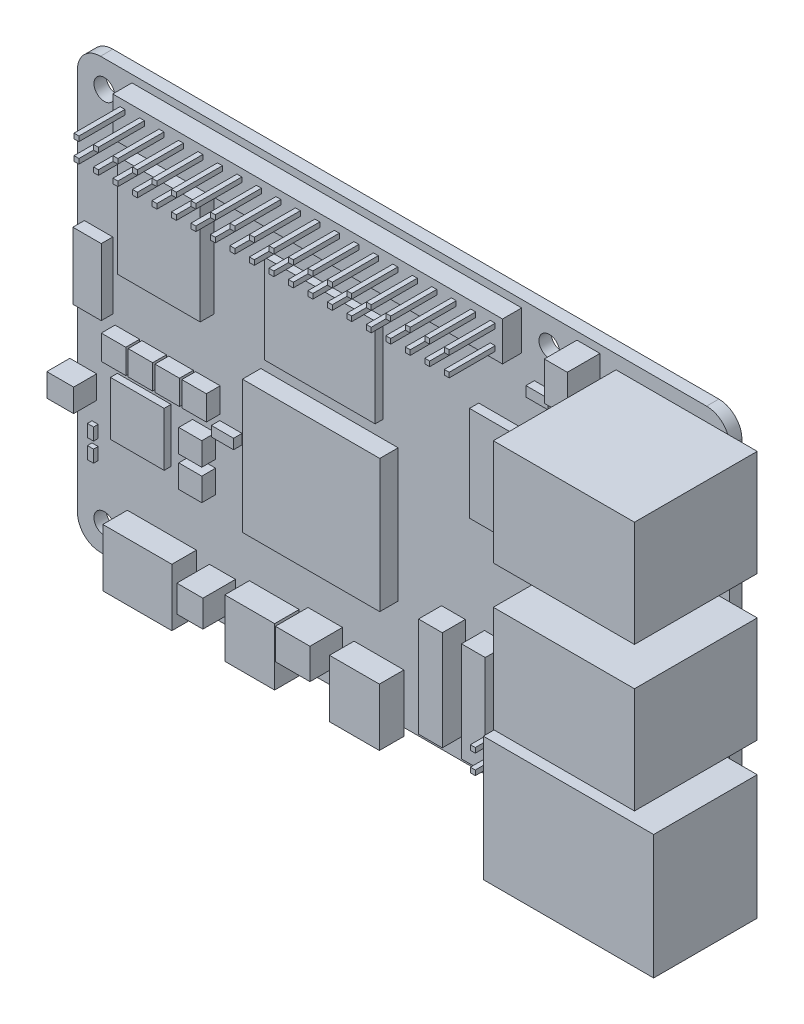
from build123d import *

# Parameters (mm, degrees)
PCB_DEPTH              = 1.6
SKETCH2_W              = 50.8
SKETCH2_H              = 5.08
SKETCH2_W_2            = 5.08
HEADER_BLOCKS_DEPTH    = 2.5
SKETCH3_W              = 0.64
SKETCH3_H              = 0.64
HEADER_PINS_DEPTH      = 6
SKETCH4_W              = 0.8
SKETCH4_H              = 1.6
PARTS_H0_6_DEPTH       = 0.6
SKETCH5_W              = 7
SKETCH5_H              = 7
PARTS_H0_9_DEPTH       = 0.9
SKETCH6_W              = 14.4
SKETCH6_H              = 11.6
SKETCH6_W_2            = 4
SKETCH6_H_2            = 4.5
PARTS_H1_DEPTH         = 1
SKETCH7_W              = 2.9
SKETCH7_H              = 1.3
PARTS_H1_1_DEPTH       = 1.1
SKETCH8_W              = 12.9
SKETCH8_H              = 12.4
PARTS_H1_2_DEPTH       = 1.2
SKETCH9_W              = 3.7
SKETCH9_H              = 8.7
PARTS_H1_5_DEPTH       = 1.5
SKETCH10_W             = 10.8
SKETCH10_H             = 13.3
SKETCH10_W_2           = 3.2
SKETCH10_H_2           = 3.2
SKETCH10_W_3           = 3
SKETCH10_H_3           = 3
PARTS_H1_8_DEPTH       = 1.8
SKETCH11_W             = 17.9
SKETCH11_H             = 17.3
PARTS_H2_4_DEPTH       = 2.4
SKETCH12_W             = 3.1
SKETCH12_H             = 13
SKETCH12_W_2           = 3.5
SKETCH12_H_2           = 3
PARTS_H3_DEPTH         = 3
SKETCH13_W             = 6.5
SKETCH13_H             = 7.5
SKETCH13_W_2           = 9
PARTS_H3_2_DEPTH       = 3.2
SKETCH14_W             = 3
SKETCH14_H             = 5
SKETCH14_W_2           = 4.5
SKETCH14_H_2           = 4
SKETCH14_W_3           = 3.4
SKETCH14_H_3           = 3.5
PARTS_H4_25_DEPTH      = 4.25
SKETCH15_W             = 22.2
SKETCH15_H             = 16.2
PARTS_H13_5_DEPTH      = 13.5
SKETCH16_W             = 18.4
SKETCH16_H             = 13.8
PARTS_H16_DEPTH        = 16
MOUNT_HOLES_DEPTH      = 107.281324794
MOUNT_HOLES_DEPTH_BACK = 107.281324794
SKETCH17_R             = 1.35


with BuildPart() as part:
    # Sketch1 → PCB (new body)
    with BuildSketch(Plane.XY):
        with BuildLine():
            Line((3, 0), (82, 0))
            ThreePointArc((82, 0), (84.121320344, 0.878679656), (85, 3))
            Line((85, 3), (85, 53))
            ThreePointArc((85, 53), (84.121320344, 55.121320344), (82, 56))
            Line((82, 56), (3, 56))
            ThreePointArc((3, 56), (0.878679656, 55.121320344), (0, 53))
            Line((0, 53), (0, 3))
            ThreePointArc((0, 3), (0.878679656, 0.878679656), (3, 0))
        make_face()
    extrude(amount=PCB_DEPTH)

    # Sketch2 → Header_Blocks (add)
    with BuildSketch(Plane.XY.offset(1.6)):
        with Locations((32.5, 52.5)):
            Rectangle(SKETCH2_W, SKETCH2_H)
        with Locations((61.3, 9.3)):
            Rectangle(SKETCH2_W_2, SKETCH2_H)
    extrude(amount=HEADER_BLOCKS_DEPTH)

    # Sketch3 → Header_Pins (add)
    with BuildSketch(Plane.XY.offset(4.1)):
        with Locations((8.37, 51.23)):
            Rectangle(SKETCH3_W, SKETCH3_H)
        with Locations((8.37, 53.77)):
            Rectangle(SKETCH3_W, SKETCH3_H)
        with Locations((10.91, 51.23)):
            Rectangle(SKETCH3_W, SKETCH3_H)
        with Locations((10.91, 53.77)):
            Rectangle(SKETCH3_W, SKETCH3_H)
        with Locations((13.45, 51.23)):
            Rectangle(SKETCH3_W, SKETCH3_H)
        with Locations((13.45, 53.77)):
            Rectangle(SKETCH3_W, SKETCH3_H)
        with Locations((15.99, 51.23)):
            Rectangle(SKETCH3_W, SKETCH3_H)
        with Locations((15.99, 53.77)):
            Rectangle(SKETCH3_W, SKETCH3_H)
        with Locations((18.53, 51.23)):
            Rectangle(SKETCH3_W, SKETCH3_H)
        with Locations((18.53, 53.77)):
            Rectangle(SKETCH3_W, SKETCH3_H)
        with Locations((21.07, 51.23)):
            Rectangle(SKETCH3_W, SKETCH3_H)
        with Locations((21.07, 53.77)):
            Rectangle(SKETCH3_W, SKETCH3_H)
        with Locations((23.61, 51.23)):
            Rectangle(SKETCH3_W, SKETCH3_H)
        with Locations((23.61, 53.77)):
            Rectangle(SKETCH3_W, SKETCH3_H)
        with Locations((26.15, 51.23)):
            Rectangle(SKETCH3_W, SKETCH3_H)
        with Locations((26.15, 53.77)):
            Rectangle(SKETCH3_W, SKETCH3_H)
        with Locations((28.69, 51.23)):
            Rectangle(SKETCH3_W, SKETCH3_H)
        with Locations((28.69, 53.77)):
            Rectangle(SKETCH3_W, SKETCH3_H)
        with Locations((31.23, 51.23)):
            Rectangle(SKETCH3_W, SKETCH3_H)
        with Locations((31.23, 53.77)):
            Rectangle(SKETCH3_W, SKETCH3_H)
        with Locations((33.77, 51.23)):
            Rectangle(SKETCH3_W, SKETCH3_H)
        with Locations((33.77, 53.77)):
            Rectangle(SKETCH3_W, SKETCH3_H)
        with Locations((36.31, 51.23)):
            Rectangle(SKETCH3_W, SKETCH3_H)
        with Locations((36.31, 53.77)):
            Rectangle(SKETCH3_W, SKETCH3_H)
        with Locations((38.85, 51.23)):
            Rectangle(SKETCH3_W, SKETCH3_H)
        with Locations((38.85, 53.77)):
            Rectangle(SKETCH3_W, SKETCH3_H)
        with Locations((41.39, 51.23)):
            Rectangle(SKETCH3_W, SKETCH3_H)
        with Locations((41.39, 53.77)):
            Rectangle(SKETCH3_W, SKETCH3_H)
        with Locations((43.93, 51.23)):
            Rectangle(SKETCH3_W, SKETCH3_H)
        with Locations((43.93, 53.77)):
            Rectangle(SKETCH3_W, SKETCH3_H)
        with Locations((46.47, 51.23)):
            Rectangle(SKETCH3_W, SKETCH3_H)
        with Locations((46.47, 53.77)):
            Rectangle(SKETCH3_W, SKETCH3_H)
        with Locations((49.01, 51.23)):
            Rectangle(SKETCH3_W, SKETCH3_H)
        with Locations((49.01, 53.77)):
            Rectangle(SKETCH3_W, SKETCH3_H)
        with Locations((51.55, 51.23)):
            Rectangle(SKETCH3_W, SKETCH3_H)
        with Locations((51.55, 53.77)):
            Rectangle(SKETCH3_W, SKETCH3_H)
        with Locations((54.09, 51.23)):
            Rectangle(SKETCH3_W, SKETCH3_H)
        with Locations((54.09, 53.77)):
            Rectangle(SKETCH3_W, SKETCH3_H)
        with Locations((56.63, 51.23)):
            Rectangle(SKETCH3_W, SKETCH3_H)
        with Locations((56.63, 53.77)):
            Rectangle(SKETCH3_W, SKETCH3_H)
        with Locations((60.03, 8.03)):
            Rectangle(SKETCH3_W, SKETCH3_H)
        with Locations((60.03, 10.57)):
            Rectangle(SKETCH3_W, SKETCH3_H)
        with Locations((62.57, 8.03)):
            Rectangle(SKETCH3_W, SKETCH3_H)
        with Locations((62.57, 10.57)):
            Rectangle(SKETCH3_W, SKETCH3_H)
    extrude(amount=HEADER_PINS_DEPTH)

    # Sketch4 → Parts_h0_6 (add)
    with BuildSketch(Plane.XY.offset(1.6)):
        with Locations((2.3, 11)):
            Rectangle(SKETCH4_W, SKETCH4_H)
        with Locations((2.3, 13.5)):
            Rectangle(SKETCH4_W, SKETCH4_H)
    extrude(amount=PARTS_H0_6_DEPTH)

    # Sketch5 → Parts_h0_9 (add)
    with BuildSketch(Plane.XY.offset(1.6)):
        Polygon((62.7, 19.918019485), (65.881980515, 23.1), (62.7, 26.281980515), (59.518019485, 23.1), align=None)
        with Locations((8.7, 17.8)):
            Rectangle(SKETCH5_W, SKETCH5_H)
    extrude(amount=PARTS_H0_9_DEPTH)

    # Sketch6 → Parts_h1 (add)
    with BuildSketch(Plane.XY.offset(1.6)):
        with Locations((32.6, 39.2)):
            Rectangle(SKETCH6_W, SKETCH6_H)
        with Locations((67.4, 45.6)):
            Rectangle(SKETCH6_W_2, SKETCH6_H_2)
    extrude(amount=PARTS_H1_DEPTH)

    # Sketch7 → Parts_h1_1 (add)
    with BuildSketch(Plane.XY.offset(1.6)):
        with Locations((20, 22)):
            Rectangle(SKETCH7_W, SKETCH7_H)
        with Locations((59.5, 18)):
            Rectangle(SKETCH7_W, SKETCH7_H)
        with Locations((61, 47)):
            Rectangle(SKETCH7_W, SKETCH7_H)
    extrude(amount=PARTS_H1_1_DEPTH)

    # Sketch8 → Parts_h1_2 (add)
    with BuildSketch(Plane.XY.offset(1.6)):
        with Locations((58.75, 35.3)):
            Rectangle(SKETCH8_W, SKETCH8_H)
    extrude(amount=PARTS_H1_2_DEPTH)

    # Sketch9 → Parts_h1_5 (add)
    with BuildSketch(Plane.XY.offset(1.6)):
        with Locations((2.75, 32.05)):
            Rectangle(SKETCH9_W, SKETCH9_H)
    extrude(amount=PARTS_H1_5_DEPTH)

    # Sketch10 → Parts_h1_8 (add)
    with BuildSketch(Plane.XY.offset(1.6)):
        with Locations((12.4, 40.95)):
            Rectangle(SKETCH10_W, SKETCH10_H)
        with Locations((6.5, 25)):
            Rectangle(SKETCH10_W_2, SKETCH10_H_2)
        with Locations((10, 25)):
            Rectangle(SKETCH10_W_2, SKETCH10_H_2)
        with Locations((13.5, 25)):
            Rectangle(SKETCH10_W_2, SKETCH10_H_2)
        with Locations((17, 25)):
            Rectangle(SKETCH10_W_2, SKETCH10_H_2)
        with Locations((16.5, 19.5)):
            Rectangle(SKETCH10_W_3, SKETCH10_H_3)
        with Locations((16.5, 15.5)):
            Rectangle(SKETCH10_W_3, SKETCH10_H_3)
    extrude(amount=PARTS_H1_8_DEPTH)

    # Sketch11 → Parts_h2_4 (add)
    with BuildSketch(Plane.XY.offset(1.6)):
        with Locations((32.85, 22.55)):
            Rectangle(SKETCH11_W, SKETCH11_H)
    extrude(amount=PARTS_H2_4_DEPTH)

    # Sketch12 → Parts_h3 (add)
    with BuildSketch(Plane.XY.offset(1.6)):
        with Locations((54.6, 9.7)):
            Rectangle(SKETCH12_W, SKETCH12_H)
        with Locations((49, 9.7)):
            Rectangle(SKETCH12_W, SKETCH12_H)
        with Locations((0.75, 18.4)):
            Rectangle(SKETCH12_W_2, SKETCH12_H_2)
    extrude(amount=PARTS_H3_DEPTH)

    # Sketch13 → Parts_h3_2 (add)
    with BuildSketch(Plane.XY.offset(1.6)):
        with Locations((25.65, 2.75)):
            Rectangle(SKETCH13_W, SKETCH13_H)
        with Locations((39.3, 2.75)):
            Rectangle(SKETCH13_W, SKETCH13_H)
        with Locations((11, 2.75)):
            Rectangle(SKETCH13_W_2, SKETCH13_H)
    extrude(amount=PARTS_H3_2_DEPTH)

    # Sketch14 → Parts_h4_25 (add)
    with BuildSketch(Plane.XY.offset(1.6)):
        with Locations((66.6, 52.5)):
            Rectangle(SKETCH14_W, SKETCH14_H)
        with Locations((32.3, 5.3)):
            Rectangle(SKETCH14_W_2, SKETCH14_H_2)
        with Locations((18.9, 4)):
            Rectangle(SKETCH14_W_3, SKETCH14_H_3)
    extrude(amount=PARTS_H4_25_DEPTH)

    # Sketch15 → Parts_h13_5 (add)
    with BuildSketch(Plane.XY.offset(1.6)):
        with Locations((77.5, 9.6)):
            Rectangle(SKETCH15_W, SKETCH15_H)
    extrude(amount=PARTS_H13_5_DEPTH)

    # Sketch16 → Parts_h16 (add)
    with BuildSketch(Plane.XY.offset(1.6)):
        with Locations((79.4, 47.3)):
            Rectangle(SKETCH16_W, SKETCH16_H)
        with Locations((79.4, 28.5)):
            Rectangle(SKETCH16_W, SKETCH16_H)
    extrude(amount=PARTS_H16_DEPTH)

    # Sketch17 → Mount_Holes (cut, two sides: drawn at the far end of the back side and taken through both)
    with BuildSketch(Plane.XY.offset(-MOUNT_HOLES_DEPTH_BACK)):
        with Locations((3.5, 3.5)):
            Circle(SKETCH17_R)
        with Locations((3.5, 52.5)):
            Circle(SKETCH17_R)
        with Locations((61.5, 3.5)):
            Circle(SKETCH17_R)
        with Locations((61.5, 52.5)):
            Circle(SKETCH17_R)
    extrude(amount=MOUNT_HOLES_DEPTH + MOUNT_HOLES_DEPTH_BACK, mode=Mode.SUBTRACT)


solid = part.part
